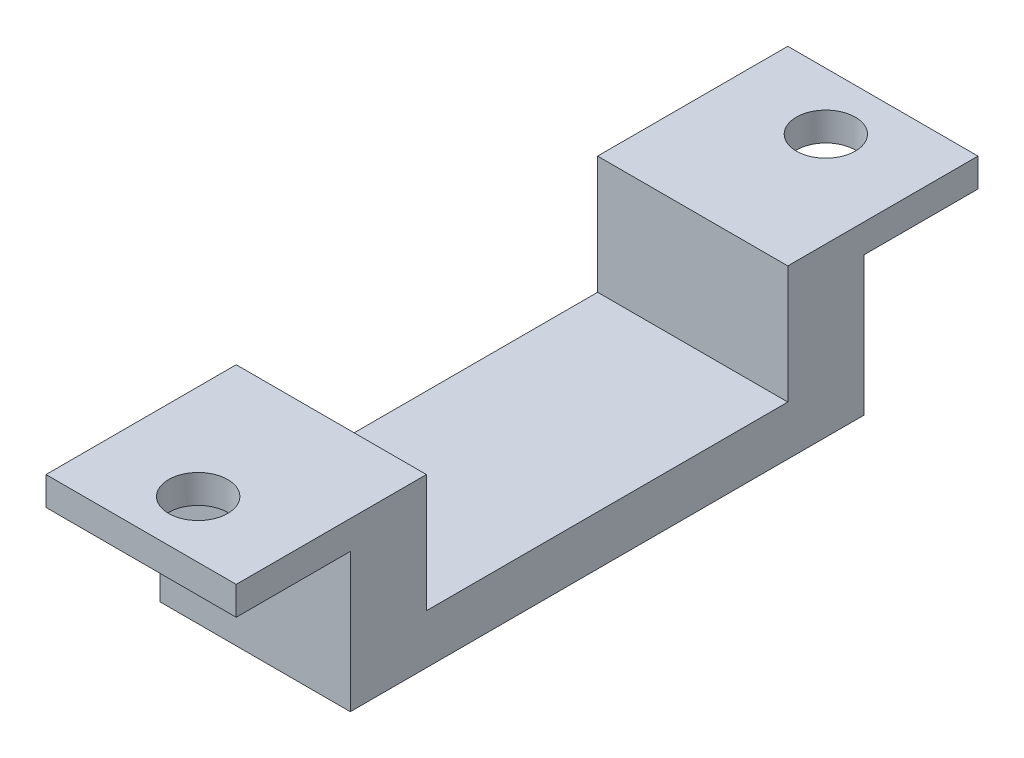
from build123d import *

# Parameters (mm, degrees)
CROQUIS1_W              = 10
CROQUIS1_H              = 27
SALIENTE_EXTRUIR1_DEPTH = 2.6
CROQUIS2_W              = 10
CROQUIS2_H              = 4
SALIENTE_EXTRUIR2_DEPTH = 6.2
CROQUIS3_W              = 10
CROQUIS3_H              = 1.5
SALIENTE_EXTRUIR3_DEPTH = 6
CROQUIS4_R              = 1.55
CORTAR_EXTRUIR1_DEPTH   = 5


with BuildPart() as part:
    # Croquis1 → Saliente-Extruir1 (new body)
    with BuildSketch(Plane(origin=(0, 0, 0), x_dir=(1, 0, 0), z_dir=(0, 1, 0))):
        Rectangle(CROQUIS1_W, CROQUIS1_H)
    saliente_extruir1 = extrude(amount=SALIENTE_EXTRUIR1_DEPTH)

    # Croquis2 → Saliente-Extruir2 (add)
    with BuildSketch(Plane(origin=(0, 2.6, 0), x_dir=(1, 0, 0), z_dir=(0, 1, 0))):
        with Locations((0, 11.5)):
            Rectangle(CROQUIS2_W, CROQUIS2_H)
    saliente_extruir2 = extrude(amount=SALIENTE_EXTRUIR2_DEPTH)

    # Croquis3 → Saliente-Extruir3 (add)
    with BuildSketch(Plane(origin=(0, 0, -13.5), x_dir=(-1, 0, 0), z_dir=(0, 0, -1))):
        with Locations((0, 8.05)):
            Rectangle(CROQUIS3_W, CROQUIS3_H)
    saliente_extruir3 = extrude(amount=SALIENTE_EXTRUIR3_DEPTH)

    # Croquis4 → Cortar-Extruir1 (cut)
    with BuildSketch(Plane.XZ.offset(-7.3)):
        with Locations((0, -16.5)):
            Circle(CROQUIS4_R)
    cortar_extruir1 = extrude(amount=-CORTAR_EXTRUIR1_DEPTH, mode=Mode.SUBTRACT)

    # Simetría1: Saliente-Extruir1, Saliente-Extruir2, Saliente-Extruir3, Cortar-Extruir1 across plane
    add(saliente_extruir1.mirror(Plane.XY))
    add(saliente_extruir2.mirror(Plane.XY))
    add(saliente_extruir3.mirror(Plane.XY))
    add(cortar_extruir1.mirror(Plane.XY), mode=Mode.SUBTRACT)


solid = part.part
